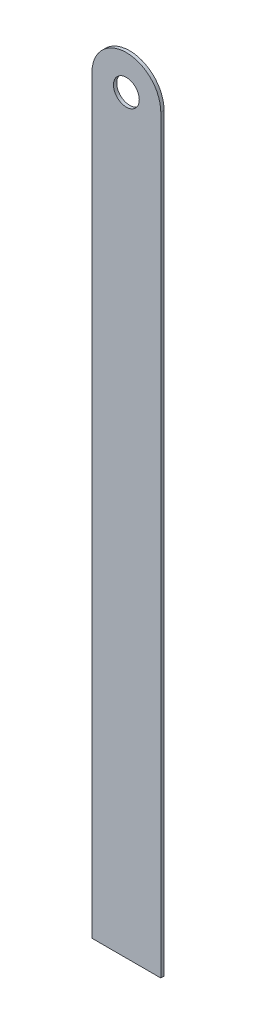
from build123d import *

# Parameters (mm, degrees)
BOSS_EXTRUDE1_DEPTH = 1.2
SKETCH2_R           = 4.7625
CUT_EXTRUDE1_DEPTH  = 152.667422013


with BuildPart() as part:
    # Sketch1 → Boss-Extrude1 (new body)
    with BuildSketch(Plane.XY):
        with BuildLine():
            ThreePointArc((12.7, 138.43), (0, 151.13), (-12.7, 138.43))
            Line((-12.7, 138.43), (-12.7, -138.43))
            Line((-12.7, -138.43), (12.7, -138.43))
            Line((12.7, -138.43), (12.7, 138.43))
        make_face()
    extrude(amount=BOSS_EXTRUDE1_DEPTH)

    # Sketch2 → Cut-Extrude1 (cut, through all)
    with BuildSketch(Plane.XY.offset(1.2)):
        with Locations((0, 138.43)):
            Circle(SKETCH2_R)
    extrude(amount=-CUT_EXTRUDE1_DEPTH, mode=Mode.SUBTRACT)


solid = part.part
